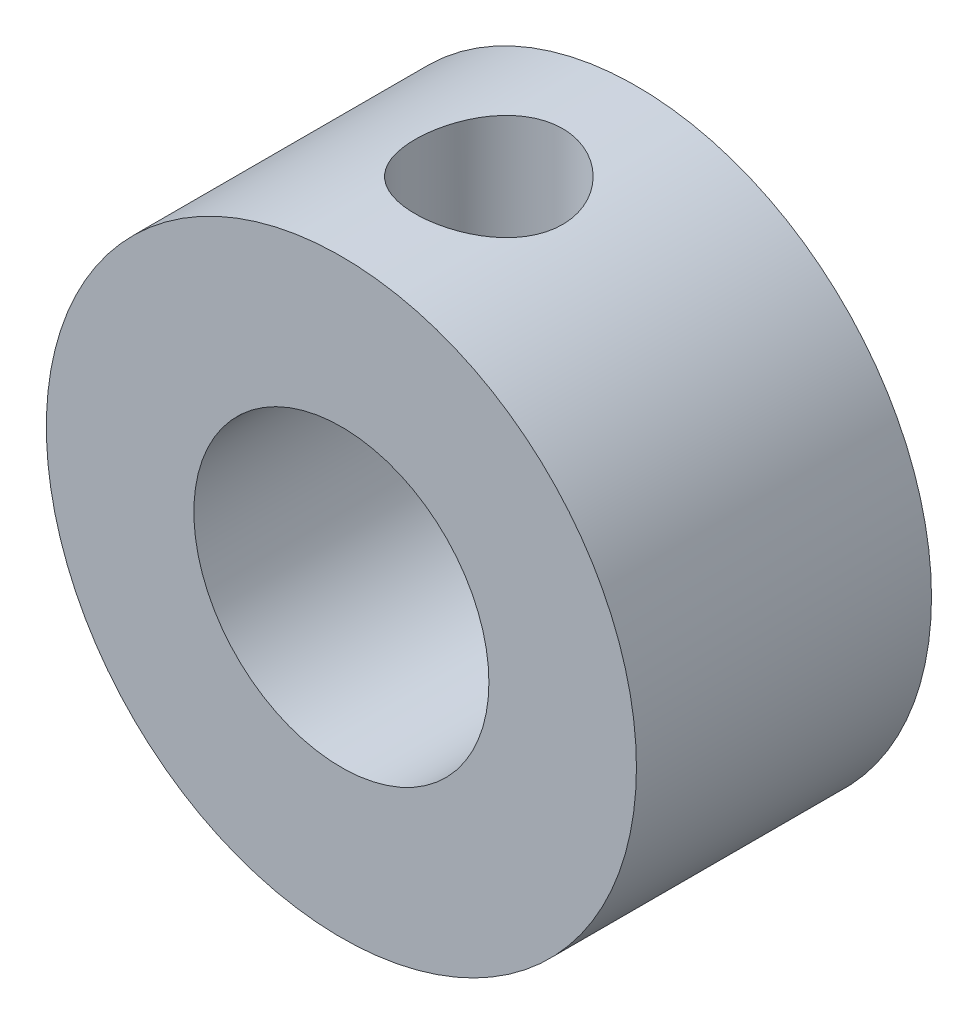
from build123d import *

# Parameters (mm, degrees)
SKETCH1_R           = 6
SKETCH1_R_2         = 3
BOSS_EXTRUDE1_DEPTH = 6
SKETCH3_R           = 1.5
CUT_EXTRUDE1_DEPTH  = 11.392304845


with BuildPart() as part:
    # Sketch1 → Boss-Extrude1 (new body)
    with BuildSketch(Plane.XY):
        Circle(SKETCH1_R)
        Circle(SKETCH1_R_2, mode=Mode.SUBTRACT)
    extrude(amount=BOSS_EXTRUDE1_DEPTH)

    # Sketch3 → Cut-Extrude1 (cut, through all)
    with BuildSketch(Plane(origin=(0, 0, 0), x_dir=(1, 0, 0), z_dir=(0, 1, 0))):
        with Locations((-0.001387252, -3)):
            Circle(SKETCH3_R)
    extrude(amount=CUT_EXTRUDE1_DEPTH, mode=Mode.SUBTRACT)


solid = part.part
